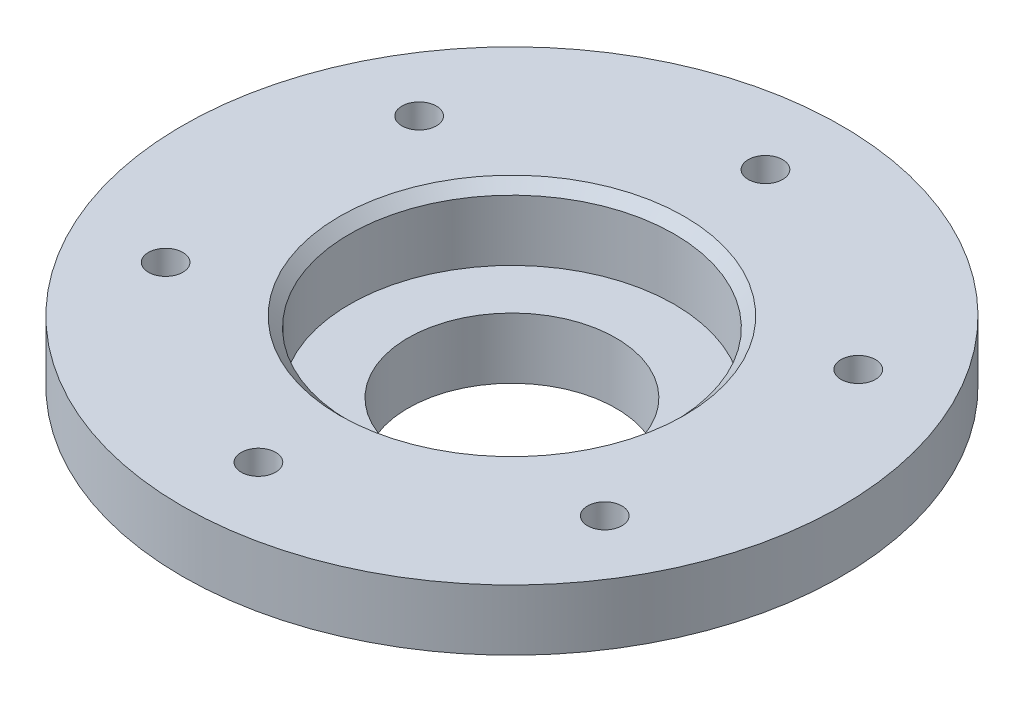
from build123d import *

# Parameters (mm, degrees)
FASE1_SIZE                                           = 1
FASE2_SIZE                                           = 1
FORMSENKUNG_F_R_M3_SENKSCHRAUBE_MIT_SCHL_D           = 3.4
FORMSENKUNG_F_R_M3_SENKSCHRAUBE_MIT_SCHL_CSINK_D     = 6.3
FORMSENKUNG_F_R_M3_SENKSCHRAUBE_MIT_SCHL_CSINK_ANGLE = 90
KREISMUSTER1_COUNT                                   = 6


with BuildPart() as part:
    # Skizze1 → Rotation1 (revolve)
    with BuildSketch(Plane.XY):
        Polygon((10.25, 0), (20, 0), (20, 7), (32.5, 7), (32.5, 13), (16, 13), (16, 6), (10.25, 6), align=None)
    revolve(axis=Axis((0, 0, 0), (0, -1, 0)))

    # Fase1
    fase1_edges = [part.edges().sort_by_distance(p)[0] for p in [
        (-16, 13, 0),
    ]]
    chamfer(fase1_edges, length=FASE1_SIZE)

    # Fase2
    fase2_edges = [part.edges().sort_by_distance(p)[0] for p in [
        (-20, 0, 0),
    ]]
    chamfer(fase2_edges, length=FASE2_SIZE)

    # Formsenkung für M3 Senkschraube mit Schlitz/Kreuzschlitz1 (through all)
    with Locations(Plane(origin=(0, 7, 0), x_dir=(-1, 0, 0), z_dir=(0, -1, 0))):
        with Locations((0, 25)):
            formsenkung_f_r_m3_senkschraube_mit_schl = CounterSinkHole(FORMSENKUNG_F_R_M3_SENKSCHRAUBE_MIT_SCHL_D / 2, FORMSENKUNG_F_R_M3_SENKSCHRAUBE_MIT_SCHL_CSINK_D / 2, counter_sink_angle=FORMSENKUNG_F_R_M3_SENKSCHRAUBE_MIT_SCHL_CSINK_ANGLE)

    # Kreismuster1: Formsenkung für M3 Senkschraube mit Schlitz/Kreuzschlitz1 ×6 about axis
    kreismuster1_axis = Axis((0, 0, 0), (0, -1, 0))
    for i in range(1, KREISMUSTER1_COUNT):
        add(formsenkung_f_r_m3_senkschraube_mit_schl.rotate(kreismuster1_axis, i * 360 / KREISMUSTER1_COUNT), mode=Mode.SUBTRACT)


solid = part.part
